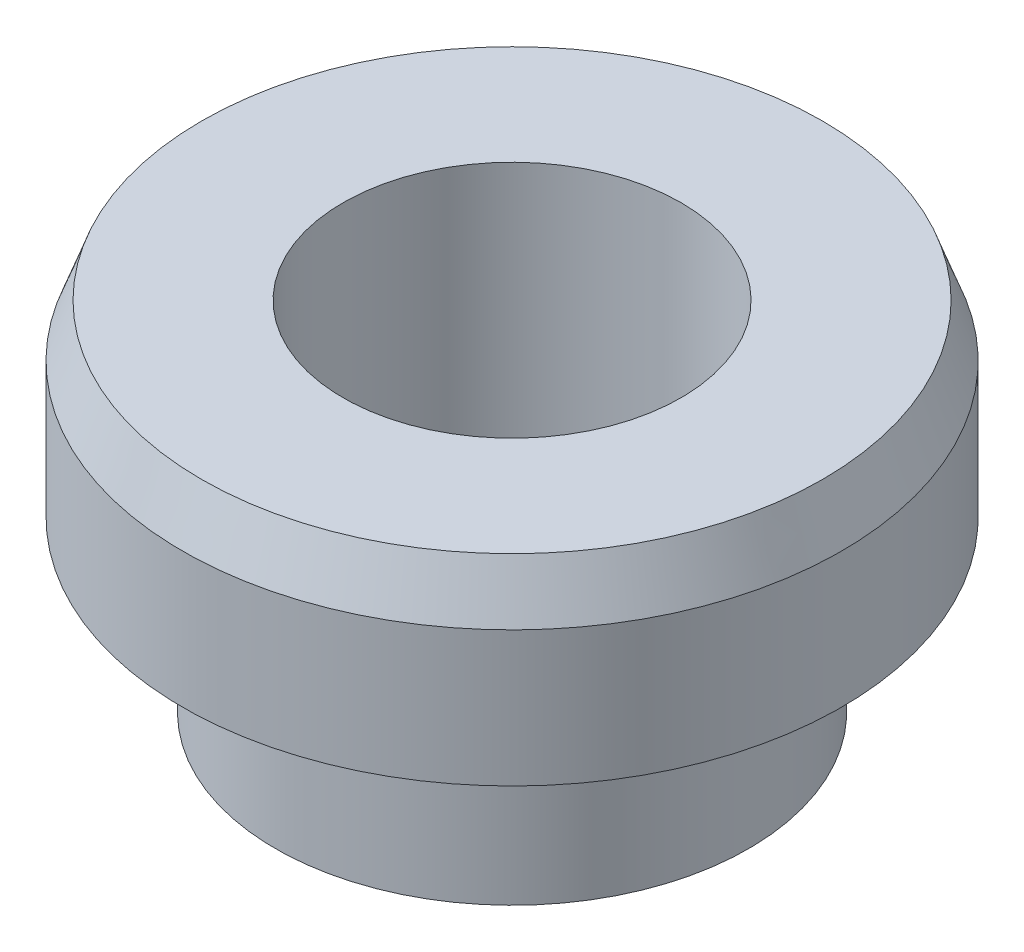
from build123d import *


with BuildPart() as part:
    # Sketch1 → Revolve1 (revolve)
    with BuildSketch(Plane.XY):
        Polygon((9.75, 8.909211316), (9.75, 4.909211316), (7, 4.909211316), (7, -0.090788684), (5, -0.090788684), (5, 10.461781218), (9.184910769, 10.461781218), align=None)
    revolve(axis=Axis((0, 0, 0), (0, 1, 0)))


solid = part.part
